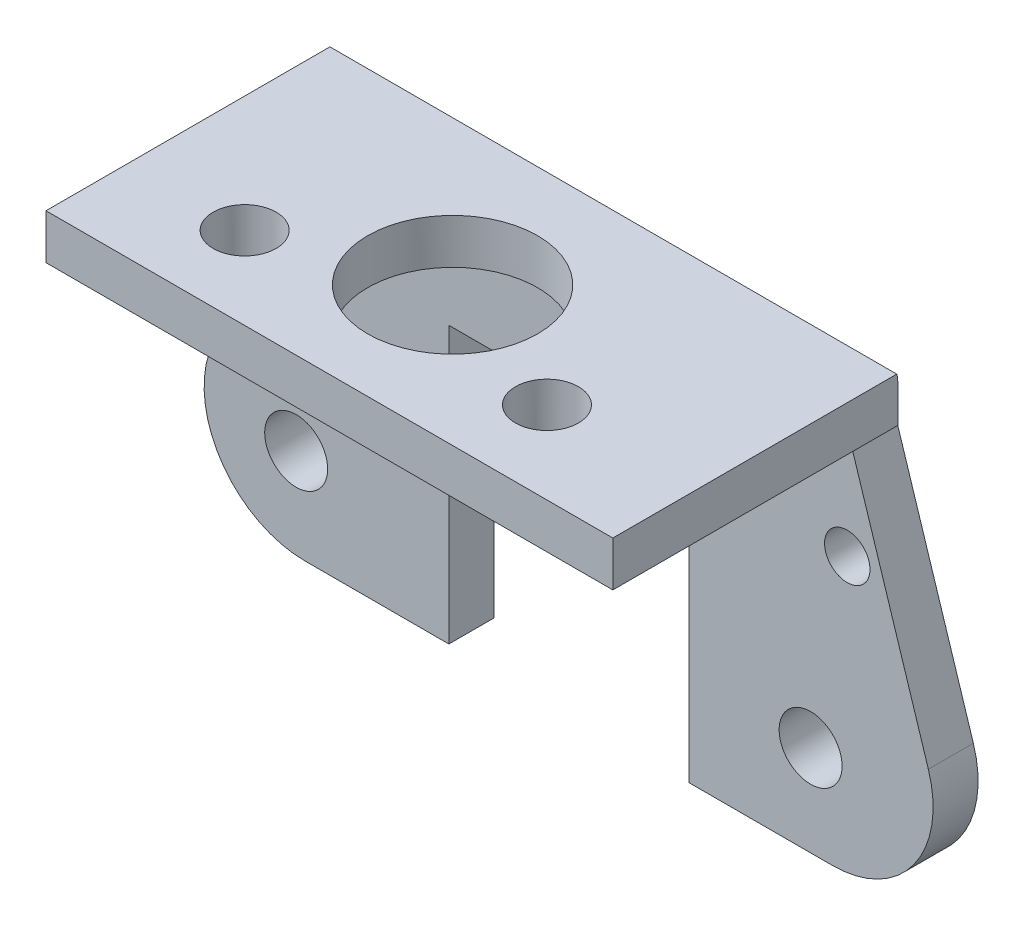
from build123d import *

# Parameters (mm, degrees)
BOSS_EXTRUDE1_DEPTH              = 3.571875
SKETCH2_W                        = 45
SKETCH2_H                        = 3.571875
BOSS_EXTRUDE2_DEPTH              = 19.05
F_5_0_5_DIAMETER_HOLE1_D         = 5
F_5_0_5_DIAMETER_HOLE1_DEPTH     = 22.621875
FILLET1_R                        = 2
F_13_5_13_5_DIAMETER_HOLE1_D     = 13.5
F_13_5_13_5_DIAMETER_HOLE1_DEPTH = 34.276761893
F_5_0_5_DIAMETER_HOLE2_D         = 5
F_5_0_5_DIAMETER_HOLE2_DEPTH     = 34.276761893
SKETCH9_W                        = 45
SKETCH9_H                        = 1.428125
CUT_EXTRUDE1_DEPTH               = 10
SKETCH10_R                       = 1.8034
CUT_EXTRUDE2_DEPTH               = 47.138995469
SKETCH11_W                       = 19.05
SKETCH11_H                       = 21.916028191
CUT_EXTRUDE3_DEPTH               = 47.138995469


with BuildPart() as part:
    # Sketch1 → Boss-Extrude1 (new body)
    with BuildSketch(Plane.XY.offset(5)):
        with BuildLine():
            Line((-21.229980824, 0), (-27.336443266, -18.80609256))
            ThreePointArc((-27.336443266, -18.80609256), (-26.199197486, -25.979667662), (-19.727514758, -29.276761893))
            Line((-19.727514758, -29.276761893), (22.145905459, -29.276761893))
            ThreePointArc((22.145905459, -29.276761893), (28.60379109, -25.99859556), (29.769170906, -18.850690187))
            Line((29.769170906, -18.850690187), (23.770019176, 0))
            Line((23.770019176, 0), (23.770019176, 5))
            Line((23.770019176, 5), (-21.229980824, 5))
            Line((-21.229980824, 5), (-21.229980824, 0))
        make_face()
    extrude(amount=-BOSS_EXTRUDE1_DEPTH)

    # Sketch2 → Boss-Extrude2 (add)
    with BuildSketch(Plane.XY.offset(5)):
        with Locations((1.270019176, 1.7859375)):
            Rectangle(SKETCH2_W, SKETCH2_H)
    extrude(amount=BOSS_EXTRUDE2_DEPTH)

    # Ø5.0 (5) Diameter Hole1
    with Locations(Plane(origin=(0, 0, 1.428125), x_dir=(-1, 0, 0), z_dir=(0, 0, -1))):
        with Locations((-20.42, -22.057021037), (20.42, -22.057021037)):
            Hole(F_5_0_5_DIAMETER_HOLE1_D / 2, depth=F_5_0_5_DIAMETER_HOLE1_DEPTH)

    # Fillet1
    fillet1_edges = [part.edges().sort_by_distance(p)[0] for p in [
        (1.270019176, 5, 1.428125),
    ]]
    fillet(fillet1_edges, radius=FILLET1_R)

    # Ø13.5 (13.5) Diameter Hole1
    with Locations(Plane(origin=(0, 5, 0), x_dir=(1, 0, 0), z_dir=(0, 1, 0))):
        with Locations((0, -13)):
            Hole(F_13_5_13_5_DIAMETER_HOLE1_D / 2, depth=F_13_5_13_5_DIAMETER_HOLE1_DEPTH)

    # Ø5.0 (5) Diameter Hole2
    with Locations(Plane(origin=(0, 5, 0), x_dir=(1, 0, 0), z_dir=(0, 1, 0))):
        with Locations((-12, -17.51), (12, -17.51)):
            Hole(F_5_0_5_DIAMETER_HOLE2_D / 2, depth=F_5_0_5_DIAMETER_HOLE2_DEPTH)

    # Sketch9 → Cut-Extrude1 (cut)
    with BuildSketch(Plane.XY.offset(5)):
        with Locations((1.270019176, 4.2859375)):
            Rectangle(SKETCH9_W, SKETCH9_H)
    extrude(amount=-CUT_EXTRUDE1_DEPTH, mode=Mode.SUBTRACT)

    # Sketch10 → Cut-Extrude2 (cut, through all)
    with BuildSketch(Plane.XY.offset(5)):
        with Locations((23.330050049, -7.435057613)):
            Circle(SKETCH10_R)
        with Locations((-20.888731092, -7.435057613)):
            Circle(SKETCH10_R)
    extrude(amount=-CUT_EXTRUDE2_DEPTH, mode=Mode.SUBTRACT)

    # Sketch11 → Cut-Extrude3 (cut, through all)
    with BuildSketch(Plane.XY.offset(5)):
        with Locations((1.227485242, -18.318747798)):
            Rectangle(SKETCH11_W, SKETCH11_H)
    extrude(amount=-CUT_EXTRUDE3_DEPTH, mode=Mode.SUBTRACT)


solid = part.part
